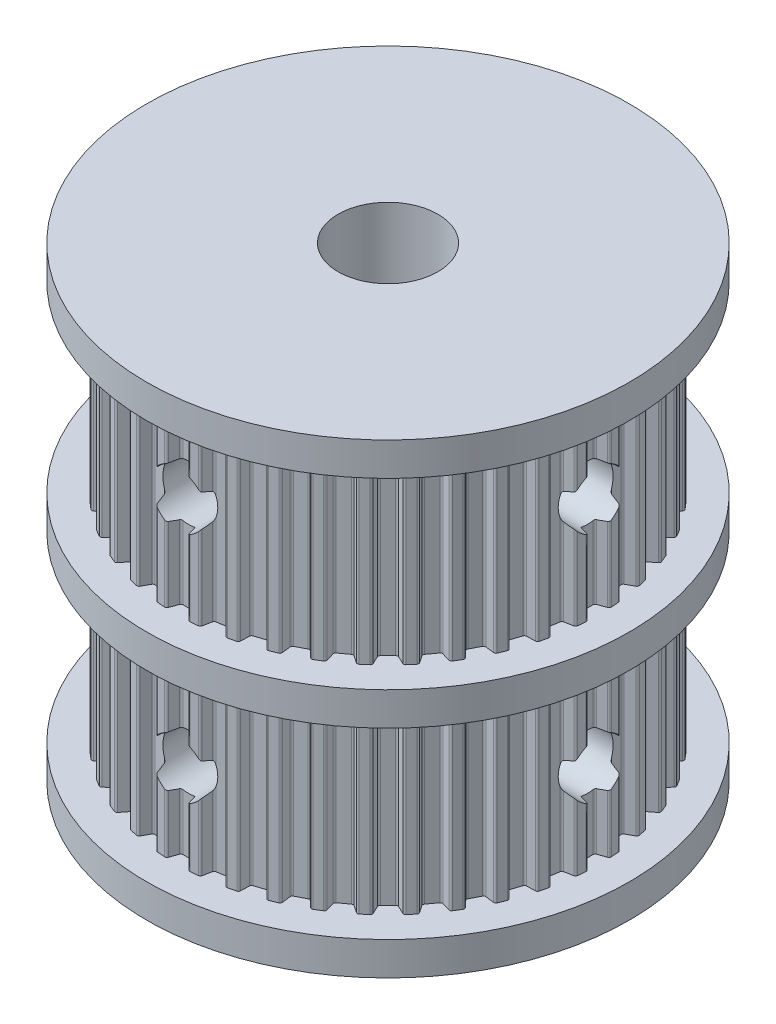
from build123d import *

# Parameters (mm, degrees)
SKETCH_1_R                         = 12.68
EXTRUDE_1_DEPTH                    = 12
CUT_EXTRUDE_1_DEPTH                = 30.959385842
FILLET_1_R                         = 0.13
PATTERN_CIRCULAR_1_COUNT           = 40
FILLET_1_OF_PATTERN_CIRCULAR_1_R   = 0.13
SKETCH_3_R                         = 14.5
EXTRUDE_2_DEPTH                    = 2
EXTRUDE_START                      = 2
SKETCH_4_R                         = 14.5
EXTRUDE_3_DEPTH                    = 2
EXTRUDE_START_2                    = -14
SKETCH_10_R                        = 14.5
EXTRUDE_4_DEPTH                    = 1
SKETCH_5_R                         = 3
CUT_EXTRUDE_2_DEPTH                = 35.705907278
SKETCH_9_W                         = 1.65
SKETCH_9_H                         = 14.5
M4X0_7_1_AT_2_COUNT                = 2
M4X0_7_1_AT_2_PITCH                = 14
PATTERN_CIRCULAR_2_COUNT           = 2
PATTERN_CIRCULAR_2_ANGLE           = 90
PATTERN_CIRCULAR_2_COPY_1_SKETCH_W = 1.65
PATTERN_CIRCULAR_2_COPY_1_SKETCH_H = 14.5


with BuildPart() as part:
    # 草圖1 → 填料-伸長1 (new, symmetric)
    with BuildSketch(Plane(origin=(0, 0, 0), x_dir=(1, 0, 0), z_dir=(0, 1, 0))):
        Circle(SKETCH_1_R)
    extrude(amount=EXTRUDE_1_DEPTH, both=True)

    # 草圖2 → 除料-伸長1 (cut, through all)
    with BuildSketch(Plane.XZ.offset(12)):
        with BuildLine():
            ThreePointArc((0.664792189, 12.662561011), (0, 12.68), (-0.664792189, 12.662561011))
            Line((-0.664792189, 12.662561011), (-0.42, 11.99))
            Line((-0.42, 11.99), (0.42, 11.99))
            Line((0.42, 11.99), (0.664792189, 12.662561011))
        make_face()
    cut_extrude_1 = extrude(amount=-CUT_EXTRUDE_1_DEPTH, mode=Mode.SUBTRACT)

    # 圓角1
    fillet_1_edges = [part.edges().sort_by_distance(p)[0] for p in [
        (-0.664792189, 0, 12.662561011),
        (0.664792189, 0, 12.662561011),
        (0.42, 0, 11.99),
        (-0.42, 0, 11.99),
    ]]
    fillet(fillet_1_edges, radius=FILLET_1_R)

    # 環狀複製排列1: 除料-伸長1 ×40 about axis
    pattern_circular_1_axis = Axis((0, 12, 0), (0, -1, 0))
    for i in range(1, PATTERN_CIRCULAR_1_COUNT):
        add(cut_extrude_1.rotate(pattern_circular_1_axis, i * 360 / PATTERN_CIRCULAR_1_COUNT), mode=Mode.SUBTRACT)

    # 圓角1 of 環狀複製排列1
    fillet_1_of_pattern_circular_1_edges = [part.edges().sort_by_distance(p)[0] for p in [
        (-2.637468451, 0, 12.402667462),
        (-1.324253464, 0, 12.610660283),
        (-1.460820133, 0, 11.908085679),
        (-2.290478339, 0, 11.776680728),
        (-4.545201487, 0, 11.837379078),
        (-3.280691602, 0, 12.248243246),
        (-3.305670026, 0, 11.532954768),
        (-4.104557499, 0, 11.273380493),
        (-6.341016578, 0, 10.980615135),
        (-5.156348224, 0, 11.584233811),
        (-5.069123352, 0, 10.873844235),
        (-5.817568832, 0, 10.492492215),
        (-7.980694797, 0, 9.853472006),
        (-6.90503844, 0, 10.634982094),
        (-6.707758037, 0, 9.946983569),
        (-7.387332313, 0, 9.453243957),
        (-9.423861822, 0, 8.483703693),
        (-8.483703693, 0, 9.423861822),
        (-8.181225458, 0, 8.775195155),
        (-8.775195155, 0, 8.181225458),
        (-10.634982094, 0, 6.90503844),
        (-9.853472006, 0, 7.980694797),
        (-9.453243957, 0, 7.387332313),
        (-9.946983569, 0, 6.707758037),
        (-11.584233811, 0, 5.156348224),
        (-10.980615135, 0, 6.341016578),
        (-10.492492215, 0, 5.817568832),
        (-10.873844235, 0, 5.069123352),
        (-12.248243246, 0, 3.280691602),
        (-11.837379078, 0, 4.545201487),
        (-11.273380493, 0, 4.104557499),
        (-11.532954768, 0, 3.305670026),
        (-12.610660283, 0, 1.324253464),
        (-12.402667462, 0, 2.637468451),
        (-11.776680728, 0, 2.290478339),
        (-11.908085679, 0, 1.460820133),
        (-12.662561011, 0, -0.664792189),
        (-12.662561011, 0, 0.664792189),
        (-11.99, 0, 0.42),
        (-11.99, 0, -0.42),
        (-12.402667462, 0, -2.637468451),
        (-12.610660283, 0, -1.324253464),
        (-11.908085679, 0, -1.460820133),
        (-11.776680728, 0, -2.290478339),
        (-11.837379078, 0, -4.545201487),
        (-12.248243246, 0, -3.280691602),
        (-11.532954768, 0, -3.305670026),
        (-11.273380493, 0, -4.104557499),
        (-10.980615135, 0, -6.341016578),
        (-11.584233811, 0, -5.156348224),
        (-10.873844235, 0, -5.069123352),
        (-10.492492215, 0, -5.817568832),
        (-9.853472006, 0, -7.980694797),
        (-10.634982094, 0, -6.90503844),
        (-9.946983569, 0, -6.707758037),
        (-9.453243957, 0, -7.387332313),
        (-8.483703693, 0, -9.423861822),
        (-9.423861822, 0, -8.483703693),
        (-8.775195155, 0, -8.181225458),
        (-8.181225458, 0, -8.775195155),
        (-6.90503844, 0, -10.634982094),
        (-7.980694797, 0, -9.853472006),
        (-7.387332313, 0, -9.453243957),
        (-6.707758037, 0, -9.946983569),
        (-5.156348224, 0, -11.584233811),
        (-6.341016578, 0, -10.980615135),
        (-5.817568832, 0, -10.492492215),
        (-5.069123352, 0, -10.873844235),
        (-3.280691602, 0, -12.248243246),
        (-4.545201487, 0, -11.837379078),
        (-4.104557499, 0, -11.273380493),
        (-3.305670026, 0, -11.532954768),
        (-1.324253464, 0, -12.610660283),
        (-2.637468451, 0, -12.402667462),
        (-2.290478339, 0, -11.776680728),
        (-1.460820133, 0, -11.908085679),
        (0.664792189, 0, -12.662561011),
        (-0.664792189, 0, -12.662561011),
        (-0.42, 0, -11.99),
        (0.42, 0, -11.99),
        (2.637468451, 0, -12.402667462),
        (1.324253464, 0, -12.610660283),
        (1.460820133, 0, -11.908085679),
        (2.290478339, 0, -11.776680728),
        (4.545201487, 0, -11.837379078),
        (3.280691602, 0, -12.248243246),
        (3.305670026, 0, -11.532954768),
        (4.104557499, 0, -11.273380493),
        (6.341016578, 0, -10.980615135),
        (5.156348224, 0, -11.584233811),
        (5.069123352, 0, -10.873844235),
        (5.817568832, 0, -10.492492215),
        (7.980694797, 0, -9.853472006),
        (6.90503844, 0, -10.634982094),
        (6.707758037, 0, -9.946983569),
        (7.387332313, 0, -9.453243957),
        (9.423861822, 0, -8.483703693),
        (8.483703693, 0, -9.423861822),
        (8.181225458, 0, -8.775195155),
        (8.775195155, 0, -8.181225458),
        (10.634982094, 0, -6.90503844),
        (9.853472006, 0, -7.980694797),
        (9.453243957, 0, -7.387332313),
        (9.946983569, 0, -6.707758037),
        (11.584233811, 0, -5.156348224),
        (10.980615135, 0, -6.341016578),
        (10.492492215, 0, -5.817568832),
        (10.873844235, 0, -5.069123352),
        (12.248243246, 0, -3.280691602),
        (11.837379078, 0, -4.545201487),
        (11.273380493, 0, -4.104557499),
        (11.532954768, 0, -3.305670026),
        (12.610660283, 0, -1.324253464),
        (12.402667462, 0, -2.637468451),
        (11.776680728, 0, -2.290478339),
        (11.908085679, 0, -1.460820133),
        (12.662561011, 0, 0.664792189),
        (12.662561011, 0, -0.664792189),
        (11.99, 0, -0.42),
        (11.99, 0, 0.42),
        (12.402667462, 0, 2.637468451),
        (12.610660283, 0, 1.324253464),
        (11.908085679, 0, 1.460820133),
        (11.776680728, 0, 2.290478339),
        (11.837379078, 0, 4.545201487),
        (12.248243246, 0, 3.280691602),
        (11.532954768, 0, 3.305670026),
        (11.273380493, 0, 4.104557499),
        (10.980615135, 0, 6.341016578),
        (11.584233811, 0, 5.156348224),
        (10.873844235, 0, 5.069123352),
        (10.492492215, 0, 5.817568832),
        (9.853472006, 0, 7.980694797),
        (10.634982094, 0, 6.90503844),
        (9.946983569, 0, 6.707758037),
        (9.453243957, 0, 7.387332313),
        (8.483703693, 0, 9.423861822),
        (9.423861822, 0, 8.483703693),
        (8.775195155, 0, 8.181225458),
        (8.181225458, 0, 8.775195155),
        (6.90503844, 0, 10.634982094),
        (7.980694797, 0, 9.853472006),
        (7.387332313, 0, 9.453243957),
        (6.707758037, 0, 9.946983569),
        (5.156348224, 0, 11.584233811),
        (6.341016578, 0, 10.980615135),
        (5.817568832, 0, 10.492492215),
        (5.069123352, 0, 10.873844235),
        (3.280691602, 0, 12.248243246),
        (4.545201487, 0, 11.837379078),
        (4.104557499, 0, 11.273380493),
        (3.305670026, 0, 11.532954768),
        (1.324253464, 0, 12.610660283),
        (2.637468451, 0, 12.402667462),
        (2.290478339, 0, 11.776680728),
        (1.460820133, 0, 11.908085679),
    ]]
    fillet(fillet_1_of_pattern_circular_1_edges, radius=FILLET_1_OF_PATTERN_CIRCULAR_1_R)

    # 草圖3 → 填料-伸長2 (add)
    with BuildSketch(Plane(origin=(0, 12, 0), x_dir=(1, 0, 0), z_dir=(0, 1, 0))):
        Circle(SKETCH_3_R)
    extrude(amount=EXTRUDE_2_DEPTH)

    # 草圖4 → 填料-伸長3 (add)
    with BuildSketch(Plane.XZ.offset(12).offset(EXTRUDE_START)):
        Circle(SKETCH_4_R)
    extrude(amount=-EXTRUDE_3_DEPTH)

    # 草圖10 → 填料-伸長4 (add, symmetric)
    with BuildSketch(Plane.XZ.offset(14).offset(EXTRUDE_START_2)):
        Circle(SKETCH_10_R)
    extrude(amount=EXTRUDE_4_DEPTH, both=True)

    # 草圖5 → 除料-伸長2 (cut, through all)
    with BuildSketch(Plane.XZ.offset(14)):
        Circle(SKETCH_5_R)
    extrude(amount=-CUT_EXTRUDE_2_DEPTH, mode=Mode.SUBTRACT)

    # 草圖9 → M4x0.7 螺紋孔1 (revolve, cut)
    with BuildSketch(Plane(origin=(0, -7, 0), x_dir=(0, 1, 0), z_dir=(1, 0, 0))):
        with Locations((0.825, 7.25)):
            Rectangle(SKETCH_9_W, SKETCH_9_H)
    m4x0_7_1 = revolve(axis=Axis((0, -7, -6.35), (0, 0, 1)), mode=Mode.SUBTRACT)

    # M4x0.7 螺紋孔1 at 2: M4x0.7 螺紋孔1 ×2
    with Locations(*[(0, i * M4X0_7_1_AT_2_PITCH, 0) for i in range(1, M4X0_7_1_AT_2_COUNT)]):
        add(m4x0_7_1, mode=Mode.SUBTRACT)

    # 環狀複製排列2: M4x0.7 螺紋孔1 ×2 about axis
    pattern_circular_2_axis = Axis((0, 14, 0), (0, 1, 0))
    for i in range(1, PATTERN_CIRCULAR_2_COUNT):
        add(m4x0_7_1.rotate(pattern_circular_2_axis, i * PATTERN_CIRCULAR_2_ANGLE / (PATTERN_CIRCULAR_2_COUNT - 1)), mode=Mode.SUBTRACT)

    # 環狀複製排列2 copy 1 sketch → 環狀複製排列2 copy 1 (revolve, cut)
    with BuildSketch(Plane(origin=(0, 7, 0), x_dir=(0, 1, 0), z_dir=(0, 0, -1))):
        with Locations((0.825, 7.25)):
            Rectangle(PATTERN_CIRCULAR_2_COPY_1_SKETCH_W, PATTERN_CIRCULAR_2_COPY_1_SKETCH_H)
    revolve(axis=Axis((-6.35, 7, 0), (1, 0, 0)), mode=Mode.SUBTRACT)


solid = part.part
